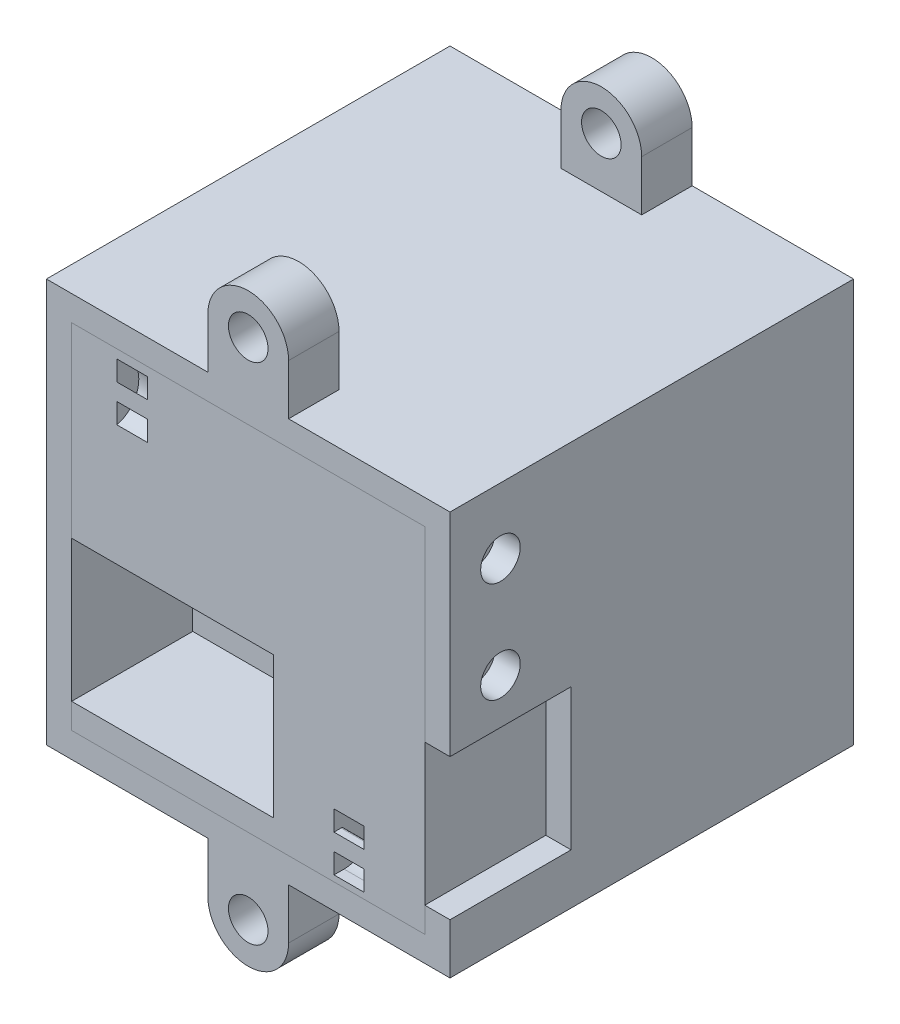
from build123d import *

# Parameters (mm, degrees)
SKETCH1_R              = 2.4892
SKETCH1_W              = 44.45
SKETCH1_H              = 44.45
BOSS_EXTRUDE2_DEPTH    = 50.8
SKETCH13_W             = 44.45
SKETCH13_H             = 19.05
BOSS_EXTRUDE3_DEPTH    = 44.45
SPLIT1_SURFACE_1_BACK  = 103.894
SPLIT1_SURFACE_1_DEPTH = 207.788
SPLIT1_SURFACE_2_BACK  = 103.894
SPLIT1_SURFACE_2_DEPTH = 207.788
SKETCH17_R             = 2.4892
CUT_EXTRUDE5_DEPTH     = 93.998779696
SKETCH15_W             = 15.24
SKETCH15_H             = 17.78
CUT_EXTRUDE4_DEPTH     = 25.4
SKETCH22_W             = 38.1
SKETCH22_H             = 11.759714853
SKETCH22_H_2           = 6.35
SKETCH22_H_3           = 50.8
CUT_EXTRUDE7_DEPTH     = 84.649049158
SKETCH25_R             = 2.4892
CUT_EXTRUDE8_DEPTH     = 92.303196275
SKETCH27_W             = 15.24
SKETCH27_H             = 17.78
CUT_EXTRUDE10_DEPTH    = 25.4
CUT_SWEEP8_START       = 5.715
CUT_SWEEP8_DEPTH       = 3.81
SKETCH43_W             = 3.81
SKETCH43_H             = 2.54
CUT_EXTRUDE11_DEPTH    = 5.08
SKETCH44_W             = 3.81
SKETCH44_H             = 2.54
CUT_EXTRUDE12_DEPTH    = 5.08
SKETCH45_W             = 3.81
SKETCH45_H             = 3.81
CUT_EXTRUDE14_DEPTH    = 2.159
FILLET1_R              = 3.81
FILLET3_R              = 0.381


# Read off the part's stored shape, not the designer's step: Cut-Sweep8
with BuildPart() as part:
    # Sketch1 → Boss-Extrude2 (new body)
    with BuildSketch(Plane.XY):
        with BuildLine():
            Line((-3.175, -3.175), (-3.175, 47.625))
            Line((-3.175, 47.625), (17.145, 47.625))
            Line((17.145, 47.625), (17.145, 53.975))
            ThreePointArc((17.145, 53.975), (22.225, 59.055), (27.305, 53.975))
            Line((27.305, 53.975), (27.305, 47.625))
            Line((27.305, 47.625), (47.625, 47.625))
            Line((47.625, 47.625), (47.625, -3.175))
            Line((47.625, -3.175), (27.305, -3.175))
            Line((27.305, -3.175), (27.305, -9.525))
            ThreePointArc((27.305, -9.525), (22.225, -14.605), (17.145, -9.525))
            Line((17.145, -9.525), (17.145, -3.175))
            Line((17.145, -3.175), (-3.175, -3.175))
        make_face()
        with Locations((22.225, 53.975)):
            Circle(SKETCH1_R, mode=Mode.SUBTRACT)
        with Locations((22.225, -9.525)):
            Circle(SKETCH1_R, mode=Mode.SUBTRACT)
        with Locations((22.225, 22.225)):
            Rectangle(SKETCH1_W, SKETCH1_H, mode=Mode.SUBTRACT)
    extrude(amount=BOSS_EXTRUDE2_DEPTH)

    # Sketch13 → Boss-Extrude3 (add)
    with BuildSketch(Plane(origin=(0, 0, 0), x_dir=(1, 0, 0), z_dir=(0, 1, 0))):
        with Locations((22.225, -41.275)):
            Rectangle(SKETCH13_W, SKETCH13_H)
    extrude(amount=BOSS_EXTRUDE3_DEPTH)


with BuildPart() as body_2:
    # Split1: the piece behind the surface
    add(part.part)
    # Split1 surface: a surface, the sketch's curves swept straight by 207.788 mm
    with BuildLine(Plane(origin=(0, 0, 31.75), x_dir=(-1, 0, 0), z_dir=(0, 0, -1)).offset(-SPLIT1_SURFACE_1_BACK), mode=Mode.PRIVATE) as split1_surface_1_path:
        Line((-44.45, 0), (0, 0))
        Line((0, 0), (0, 44.45))
        Line((0, 44.45), (-44.45, 44.45))
        Line((-44.45, 44.45), (-44.45, 0))
    split1_surface_1 = Shell.extrude(split1_surface_1_path.wire(), (0 * SPLIT1_SURFACE_1_DEPTH, 0 * SPLIT1_SURFACE_1_DEPTH, -1 * SPLIT1_SURFACE_1_DEPTH))
    split(bisect_by=split1_surface_1, keep=Keep.BOTTOM)

    # Sketch17 → Cut-Extrude5 (cut, through all)
    with BuildSketch(Plane.ZY.offset(3.175)):
        with Locations((44.45, 39.37)):
            Circle(SKETCH17_R)
        with Locations((44.45, 26.67)):
            Circle(SKETCH17_R)
    extrude(amount=-CUT_EXTRUDE5_DEPTH, mode=Mode.SUBTRACT)

    # Sketch15 → Cut-Extrude4 (cut)
    with BuildSketch(Plane(origin=(47.625, 0, 0), x_dir=(0, 0, -1), z_dir=(1, 0, 0))):
        with Locations((-43.18, 12.065)):
            Rectangle(SKETCH15_W, SKETCH15_H)
    extrude(amount=-CUT_EXTRUDE4_DEPTH, mode=Mode.SUBTRACT)

    # Sketch22 → Cut-Extrude7 (cut, through all)
    with BuildSketch(Plane(origin=(27.305, 0, 0), x_dir=(0, 0, -1), z_dir=(1, 0, 0))):
        with Locations((-25.4, -15.404857427)):
            Rectangle(SKETCH22_W, SKETCH22_H)
        with Locations((-25.4, -6.35)):
            Rectangle(SKETCH22_W, SKETCH22_H_2)
        with Locations((-25.4, 73.025)):
            Rectangle(SKETCH22_W, SKETCH22_H_3)
    extrude(amount=-CUT_EXTRUDE7_DEPTH, mode=Mode.SUBTRACT)


with BuildPart() as part_1:
    add(part.part)

    # Split1: split by a surface, the side it looks to stays
    # Split1 surface: a surface, the sketch's curves swept straight by 207.788 mm
    with BuildLine(Plane(origin=(0, 0, 31.75), x_dir=(-1, 0, 0), z_dir=(0, 0, -1)).offset(-SPLIT1_SURFACE_2_BACK), mode=Mode.PRIVATE) as split1_surface_2_path:
        Line((-44.45, 0), (0, 0))
        Line((0, 0), (0, 44.45))
        Line((0, 44.45), (-44.45, 44.45))
        Line((-44.45, 44.45), (-44.45, 0))
    split1_surface_2 = Shell.extrude(split1_surface_2_path.wire(), (0 * SPLIT1_SURFACE_2_DEPTH, 0 * SPLIT1_SURFACE_2_DEPTH, -1 * SPLIT1_SURFACE_2_DEPTH))
    split(bisect_by=split1_surface_2, keep=Keep.TOP)

    # Sketch25 → Cut-Extrude8 (cut, through all)
    with BuildSketch(Plane.ZY):
        with Locations((38.1, 39.37)):
            Circle(SKETCH25_R)
        with Locations((38.1, 26.67)):
            Circle(SKETCH25_R)
    extrude(amount=-CUT_EXTRUDE8_DEPTH, mode=Mode.SUBTRACT)

    # Sketch27 → Cut-Extrude10 (cut)
    with BuildSketch(Plane.ZY):
        with Locations((43.18, 12.065)):
            Rectangle(SKETCH27_W, SKETCH27_H)
    extrude(amount=-CUT_EXTRUDE10_DEPTH, mode=Mode.SUBTRACT)

    # Cut-Sweep8 outline → Cut-Sweep8 (cut)
    with BuildSketch(Plane.YZ.offset(CUT_SWEEP8_START)):
        with BuildLine():
            Line((38.703239312, 50.8), (36.163239312, 50.8))
            add(Edge.make_bspline(
                [(36.163239312, 50.8), (36.225534408, 50.597164917), (36.312483324, 50.346196771), (36.540975299, 49.893847377), (36.681949945, 49.671273895), (37.201643145, 49.02320701), (37.65947496, 48.657171163), (38.760225903, 48.147893995), (39.359139113, 48.040295964), (40.549690891, 48.09558808), (41.091576359, 48.267260343), (42.021692589, 48.771522476), (42.377673695, 49.091912743), (42.806183968, 49.610084567), (42.922064983, 49.785337738), (43.088653257, 50.094359328), (43.138582777, 50.224558866), (43.229332741, 50.487949571), (43.285126469, 50.642531241), (43.343215184, 50.800000001)],
                knots=[0.125824735, 0.125824735, 0.125824735, 0.125824735, 0.180460689, 0.180460689, 0.235096643, 0.235096643, 0.344368551, 0.344368551, 0.453640459, 0.453640459, 0.562912367, 0.562912367, 0.672184276, 0.672184276, 0.72682023, 0.72682023, 0.781456184, 0.781456184, 0.851866862, 0.851866862, 0.851866862, 0.851866862], degree=3))
            Line((43.343215184, 50.800000001), (40.827981558, 50.8))
            add(Edge.make_bspline(
                [(38.703239312, 50.8), (38.826689757, 50.673392723), (38.993190634, 50.54038206), (39.381954846, 50.381636812), (39.621785637, 50.324791943), (40.074002601, 50.362753286), (40.322910855, 50.426905702), (40.626904824, 50.618065), (40.735717985, 50.704946478), (40.827981558, 50.8)],
                knots=[0.125824735, 0.125824735, 0.125824735, 0.125824735, 0.235096643, 0.235096643, 0.344368551, 0.344368551, 0.453640459, 0.453640459, 0.519851531, 0.519851531, 0.519851531, 0.519851531], degree=3))
        make_face()
    extrude(amount=CUT_SWEEP8_DEPTH, mode=Mode.SUBTRACT)

    # Sketch43 → Cut-Extrude11 (cut)
    with BuildSketch(Plane.XY.offset(50.8)):
        with Locations((34.925, 2.032)):
            Rectangle(SKETCH43_W, SKETCH43_H)
    extrude(amount=-CUT_EXTRUDE11_DEPTH, mode=Mode.SUBTRACT)

    # Sketch44 → Cut-Extrude12 (cut)
    with BuildSketch(Plane.XY.offset(50.8)):
        with Locations((34.925, 6.696742258)):
            Rectangle(SKETCH44_W, SKETCH44_H)
    extrude(amount=-CUT_EXTRUDE12_DEPTH, mode=Mode.SUBTRACT)

    # Sketch45 → Cut-Extrude14 (cut)
    with BuildSketch(Plane.XZ.offset(-3.302)):
        with Locations((34.925, 47.625)):
            Rectangle(SKETCH45_W, SKETCH45_H)
    extrude(amount=-CUT_EXTRUDE14_DEPTH, mode=Mode.SUBTRACT)

    # Fillet1
    # the kernel refuses this fillet: 3.81 mm, written as the material it adds along each edge
    with BuildSketch(Plane(origin=(33.02, 7.966742258, 45.72), x_dir=(0, 0, 1), z_dir=(1, 0, 0))) as fillet1_piece_1:
        with BuildLine():
            CenterArc((FILLET1_R, FILLET1_R), FILLET1_R, 180, 90)
            Line((0, FILLET1_R), (-FILLET1_R * 0.02, FILLET1_R))
            Line((-FILLET1_R * 0.02, FILLET1_R), (-FILLET1_R * 0.02, -FILLET1_R * 0.02))
            Line((-FILLET1_R * 0.02, -FILLET1_R * 0.02), (FILLET1_R, -FILLET1_R * 0.02))
            Line((FILLET1_R, -FILLET1_R * 0.02), (FILLET1_R, 0))
        make_face()
    extrude(amount=3.81)
    with BuildSketch(Plane(origin=(36.83, 0.762, 45.72), x_dir=(0, 1, 0), z_dir=(-1, 0, 0))) as fillet1_piece_2:
        with BuildLine():
            CenterArc((FILLET1_R, -FILLET1_R), FILLET1_R, 90, 90)
            Line((0, -FILLET1_R), (-FILLET1_R * 0.02, -FILLET1_R))
            Line((-FILLET1_R * 0.02, -FILLET1_R), (-FILLET1_R * 0.02, FILLET1_R * 0.02))
            Line((-FILLET1_R * 0.02, FILLET1_R * 0.02), (FILLET1_R, FILLET1_R * 0.02))
            Line((FILLET1_R, FILLET1_R * 0.02), (FILLET1_R, 0))
        make_face()
    extrude(amount=3.81)

    # Fillet3
    fillet3_edges = [part_1.edges().sort_by_distance(p)[0] for p in [
        (34.925, 5.426742258, 49.53),
        (34.925, 3.302, 49.53),
    ]]
    fillet(fillet3_edges, radius=FILLET3_R)


solid = Compound([body_2.part, part_1.part])
